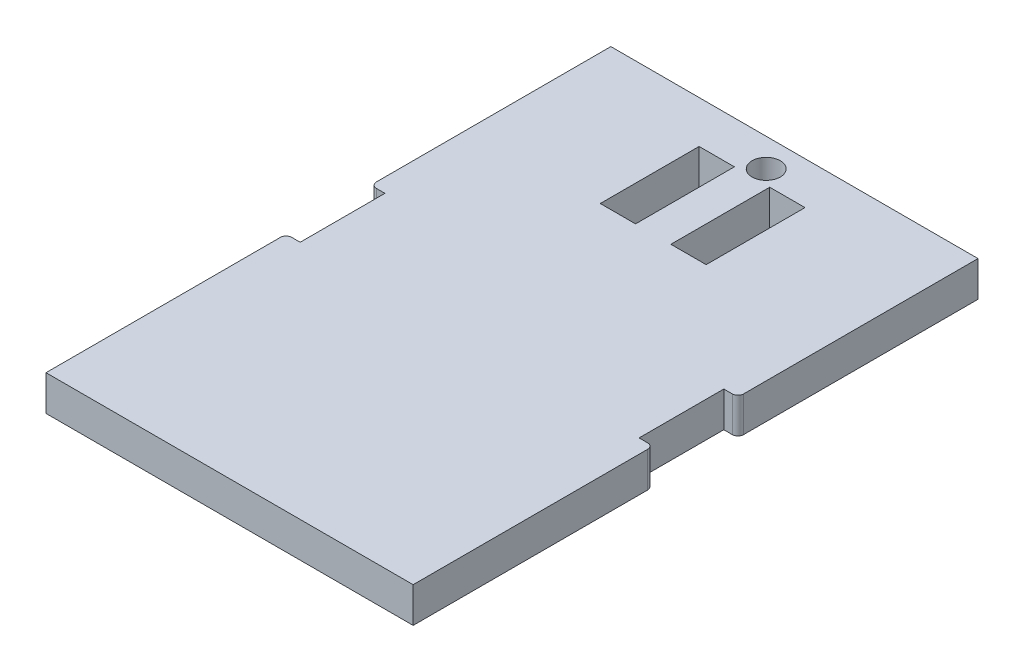
from build123d import *

# Parameters (mm, degrees)
SKETCH1_W           = 33.02
SKETCH1_H           = 50.8
SKETCH1_W_2         = 3.175
SKETCH1_H_2         = 8.89
BOSS_EXTRUDE1_DEPTH = 3.175
SKETCH3_R           = 1.27
CUT_EXTRUDE2_DEPTH  = 61.67158334
SKETCH5_W           = 1.27
SKETCH5_H           = 7.62
CUT_EXTRUDE3_DEPTH  = 61.67158334
SKETCH4_W           = 1.27
SKETCH4_H           = 7.62
CUT_EXTRUDE4_DEPTH  = 61.67158334
FILLET1_R           = 0.508


with BuildPart() as part:
    # Sketch1 → Boss-Extrude1 (new body)
    with BuildSketch(Plane(origin=(0, 0, 0), x_dir=(1, 0, 0), z_dir=(0, 1, 0))):
        with Locations((16.51, 25.4)):
            Rectangle(SKETCH1_W, SKETCH1_H)
        with Locations((13.335, 42.545)):
            Rectangle(SKETCH1_W_2, SKETCH1_H_2, mode=Mode.SUBTRACT)
        with Locations((19.685, 42.545)):
            Rectangle(SKETCH1_W_2, SKETCH1_H_2, mode=Mode.SUBTRACT)
    extrude(amount=BOSS_EXTRUDE1_DEPTH)

    # Sketch3 → Cut-Extrude2 (cut, through all)
    with BuildSketch(Plane(origin=(0, 3.175, 0), x_dir=(1, 0, 0), z_dir=(0, 1, 0))):
        with Locations((16.51, 48.26)):
            Circle(SKETCH3_R)
    extrude(amount=-CUT_EXTRUDE2_DEPTH, mode=Mode.SUBTRACT)

    # Sketch5 → Cut-Extrude3 (cut, through all)
    with BuildSketch(Plane(origin=(0, 3.175, 0), x_dir=(1, 0, 0), z_dir=(0, 1, 0))):
        with Locations((0.635, 25.4)):
            Rectangle(SKETCH5_W, SKETCH5_H)
    extrude(amount=-CUT_EXTRUDE3_DEPTH, mode=Mode.SUBTRACT)

    # Sketch4 → Cut-Extrude4 (cut, through all)
    with BuildSketch(Plane(origin=(0, 3.175, 0), x_dir=(1, 0, 0), z_dir=(0, 1, 0))):
        with Locations((32.385, 25.4)):
            Rectangle(SKETCH4_W, SKETCH4_H)
    extrude(amount=-CUT_EXTRUDE4_DEPTH, mode=Mode.SUBTRACT)

    # Fillet1
    fillet1_edges = [part.edges().sort_by_distance(p)[0] for p in [
        (33.02, 1.5875, -21.59),
        (33.02, 1.5875, -29.21),
        (0, 1.5875, -21.59),
        (0, 1.5875, -29.21),
    ]]
    fillet(fillet1_edges, radius=FILLET1_R)


solid = part.part
